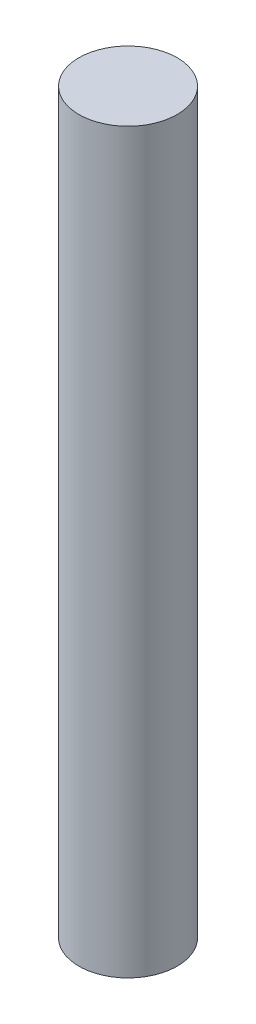
from build123d import *

# Parameters (mm, degrees)
SKETCH1_R           = 4
BOSS_EXTRUDE1_DEPTH = 60


with BuildPart() as part:
    # Sketch1 → Boss-Extrude1 (new body)
    with BuildSketch(Plane(origin=(0, 0, 0), x_dir=(1, 0, 0), z_dir=(0, 1, 0))):
        Circle(SKETCH1_R)
    extrude(amount=BOSS_EXTRUDE1_DEPTH)


solid = part.part
